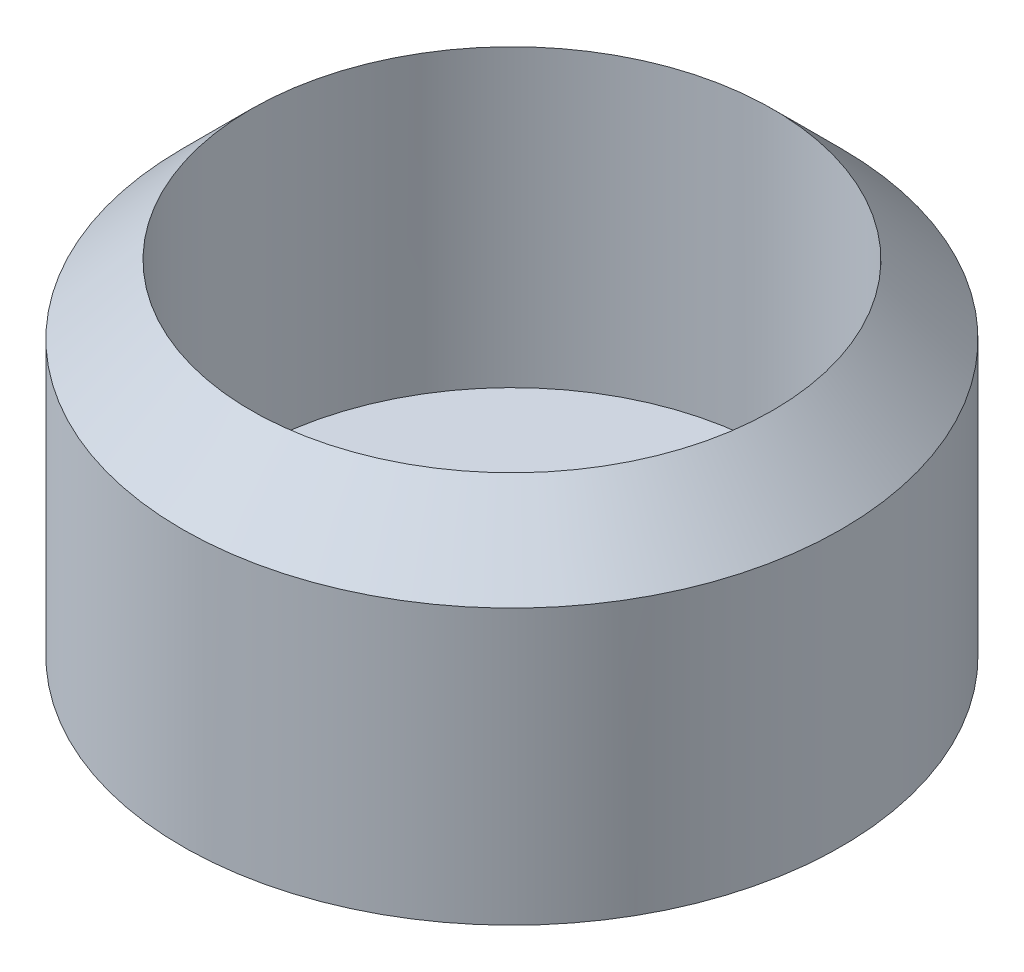
from build123d import *

# Parameters (mm, degrees)
CUT_EXTRUDE1_DEPTH      = 85.308955633
CUT_EXTRUDE1_DEPTH_BACK = 85.308955633
SKETCH2_R               = 22.5
CHAMFER1_SIZE           = 10


with BuildPart() as part:
    # Sketch1 → Revolve2 (revolve)
    with BuildSketch(Plane.XY, mode=Mode.PRIVATE) as revolve2_sk:
        Polygon((0, 0), (48, 0), (48, 50), (38, 50), (38, 7), (0, 7), align=None)
    revolve(revolve2_sk.sketch.rotate(Axis((0, 7, 0), (0, -1, 0)), 180), axis=Axis((0, 7, 0), (0, -1, 0)))

    # Sketch2 → Cut-Extrude1 (cut, two sides: drawn at the far end of the back side and taken through both)
    with BuildSketch(Plane.XZ.offset(-CUT_EXTRUDE1_DEPTH_BACK)):
        Circle(SKETCH2_R)
    extrude(amount=CUT_EXTRUDE1_DEPTH + CUT_EXTRUDE1_DEPTH_BACK, mode=Mode.SUBTRACT)

    # Chamfer1
    chamfer1_edges = [part.edges().sort_by_distance(p)[0] for p in [
        (48, 50, 0),
    ]]
    chamfer(chamfer1_edges, length=CHAMFER1_SIZE - 0.0001)  # a hair under: the kernel refuses the full size


solid = part.part
